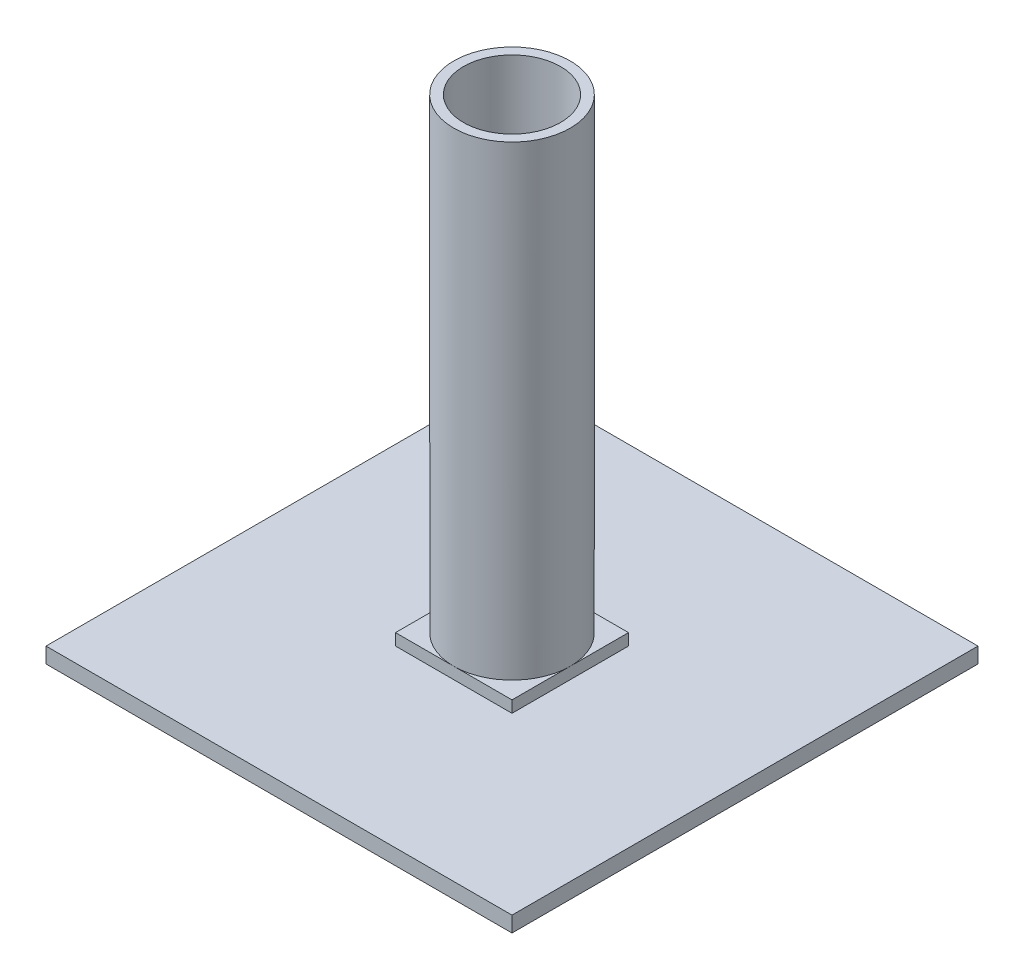
from build123d import *

# Parameters (mm, degrees)
SKETCH1_R           = 38.1
SKETCH1_R_2         = 31.75
BOSS_EXTRUDE1_DEPTH = 304.8
SKETCH2_W           = 76.2
SKETCH2_H           = 76.2
BOSS_EXTRUDE2_DEPTH = 7.62
SKETCH4_W           = 304.8
SKETCH4_H           = 304.8
BOSS_EXTRUDE4_DEPTH = 10.16


with BuildPart() as part:
    # Sketch1 → Boss-Extrude1 (new body)
    with BuildSketch(Plane(origin=(0, 0, 0), x_dir=(1, 0, 0), z_dir=(0, 1, 0))):
        Circle(SKETCH1_R)
        Circle(SKETCH1_R_2, mode=Mode.SUBTRACT)
    extrude(amount=BOSS_EXTRUDE1_DEPTH)

    # Sketch2 → Boss-Extrude2 (add)
    with BuildSketch(Plane(origin=(0, 0, 0), x_dir=(1, 0, 0), z_dir=(0, 1, 0))):
        Rectangle(SKETCH2_W, SKETCH2_H)
    extrude(amount=-BOSS_EXTRUDE2_DEPTH)

    # Sketch4 → Boss-Extrude4 (add)
    with BuildSketch(Plane(origin=(0, -7.62, 0), x_dir=(1, 0, 0), z_dir=(0, 1, 0))):
        Rectangle(SKETCH4_W, SKETCH4_H)
    extrude(amount=-BOSS_EXTRUDE4_DEPTH)


solid = part.part
